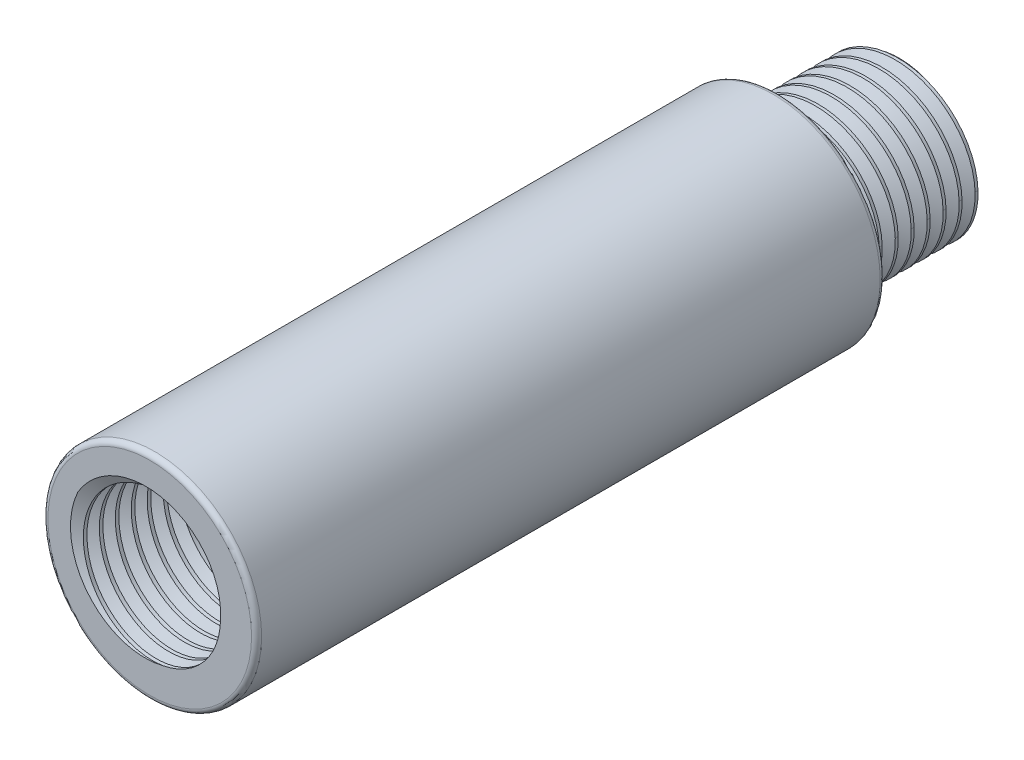
from build123d import *

# Parameters (mm, degrees)
SKETCH2_R           = 8.5
BOSS_EXTRUDE1_DEPTH = 50
FILLET1_R           = 0.4
SKETCH3_R           = 6.25
BOSS_EXTRUDE2_DEPTH = 10
CUT_SWEEP1_PITCH    = 1.27
SKETCH7_R           = 5.63
CUT_EXTRUDE1_DEPTH  = 10
CUT_SWEEP2_PITCH    = 1.27


with BuildPart() as part:
    # Sketch2 → Boss-Extrude1 (new body)
    with BuildSketch(Plane.XY):
        Circle(SKETCH2_R)
    extrude(amount=BOSS_EXTRUDE1_DEPTH)

    # Fillet1
    fillet1_edges = [part.edges().sort_by_distance(p)[0] for p in [
        (-8.5, 0, 0),
        (-8.5, 0, 50),
    ]]
    fillet(fillet1_edges, radius=FILLET1_R)

    # Sketch3 → Boss-Extrude2 (add)
    with BuildSketch(Plane(origin=(0, 0, 0), x_dir=(-1, 0, 0), z_dir=(0, 0, -1))):
        with Locations(Location((0, 0, 0), (0, 0, 180))):
            Circle(SKETCH3_R)
    extrude(amount=BOSS_EXTRUDE2_DEPTH)

    # Cut-Sweep1: arcs per turn and ends read off the stored shape
    # Cut-Sweep1: the profile of Sketch6 screwed along a right-hand helix through 8.25 turns, 8 arcs to a turn; built about Z, then put on its axis
    cut_sweep1_z = Axis((0, 0, 0), (0, 0, 1))
    cut_sweep1_corners = [(6.463090477, 0.020151731, -1.89311545), (5.352114959, 0.000938111, -1.299007519), (6.422384271, -0.020554475, -0.634431212)]
    with BuildLine(mode=Mode.PRIVATE) as cut_sweep1_profile:
        Line(cut_sweep1_corners[0], cut_sweep1_corners[1])
        Line(cut_sweep1_corners[1], cut_sweep1_corners[2])
        Line(cut_sweep1_corners[2], cut_sweep1_corners[0])
    cut_sweep1_cap = Face(cut_sweep1_profile.wire())
    cut_sweep1_turn_angles = [0, 22.5, 45, 67.5, 90, 112.5, 135, 157.5, 180, 202.5, 225, 247.5, 270, 292.5, 315, 337.5, 360]
    cut_sweep1_turn_weights = [1, 0.9238795325112867, 1, 0.9238795325112867, 1, 0.9238795325112867, 1, 0.9238795325112867, 1, 0.9238795325112867, 1, 0.9238795325112867, 1, 0.9238795325112867, 1, 0.9238795325112867, 1]
    cut_sweep1_turn_rails = [Edge.make_bspline([Vector(p[0], p[1], 0).rotate(cut_sweep1_z, cut_sweep1_turn_angles[k]) / cut_sweep1_turn_weights[k] + Vector(0, 0, p[2] + CUT_SWEEP1_PITCH * cut_sweep1_turn_angles[k] / 360) for k in range(17)], [0, 0, 0, 1, 1, 2, 2, 3, 3, 4, 4, 5, 5, 6, 6, 7, 7, 8, 8, 8], 2, cut_sweep1_turn_weights) for p in cut_sweep1_corners]
    cut_sweep1_turn_sides = [Face.make_surface_from_curves(cut_sweep1_turn_rails[p[0]], cut_sweep1_turn_rails[p[1]]) for p in [(0, 1), (1, 2), (2, 0)]]
    cut_sweep1_last_angles = [2880, 2902.5, 2925, 2947.5, 2970]
    cut_sweep1_last_weights = [1, 0.9238795325112867, 1, 0.9238795325112867, 1]
    cut_sweep1_last_rails = [Edge.make_bspline([Vector(p[0], p[1], 0).rotate(cut_sweep1_z, cut_sweep1_last_angles[k]) / cut_sweep1_last_weights[k] + Vector(0, 0, p[2] + CUT_SWEEP1_PITCH * cut_sweep1_last_angles[k] / 360) for k in range(5)], [0, 0, 0, 1, 1, 2, 2, 2], 2, cut_sweep1_last_weights) for p in cut_sweep1_corners]
    cut_sweep1_last_sides = [Face.make_surface_from_curves(cut_sweep1_last_rails[p[0]], cut_sweep1_last_rails[p[1]]) for p in [(0, 1), (1, 2), (2, 0)]]
    cut_sweep1 = Plane(origin=(0, 0, -10), x_dir=(0.7071067811865513, 0.7071067811865438, 0), z_dir=(0, 0, 1)) * Solid(Shell([*[p.moved(Location((0, 0, CUT_SWEEP1_PITCH * i))) for i in range(8) for p in cut_sweep1_turn_sides], *cut_sweep1_last_sides, cut_sweep1_cap, cut_sweep1_cap.rotate(cut_sweep1_z, 2970).moved(Location((0, 0, CUT_SWEEP1_PITCH * 2970 / 360)))]))
    add(cut_sweep1, mode=Mode.SUBTRACT)

    # Sketch7 → Cut-Extrude1 (cut)
    with BuildSketch(Plane.XY.offset(50)):
        Circle(SKETCH7_R)
    extrude(amount=-CUT_EXTRUDE1_DEPTH, mode=Mode.SUBTRACT)

    # Cut-Sweep2: arcs per turn and ends read off the stored shape
    # Cut-Sweep2: the profile of Sketch9 screwed along a right-hand helix through 7 turns, 8 arcs to a turn; built about Z, then put on its axis
    cut_sweep2_z = Axis((0, 0, 0), (0, 0, 1))
    cut_sweep2_corners = [(5.37048163, -0.023291111, -0.62125392), (6.483560981, -0.002105875, -1.211343358), (5.415659624, 0.021886883, -1.879632995)]
    with BuildLine(mode=Mode.PRIVATE) as cut_sweep2_profile:
        Line(cut_sweep2_corners[0], cut_sweep2_corners[1])
        Line(cut_sweep2_corners[1], cut_sweep2_corners[2])
        Line(cut_sweep2_corners[2], cut_sweep2_corners[0])
    cut_sweep2_cap = Face(cut_sweep2_profile.wire())
    cut_sweep2_turn_angles = [0, 22.5, 45, 67.5, 90, 112.5, 135, 157.5, 180, 202.5, 225, 247.5, 270, 292.5, 315, 337.5, 360]
    cut_sweep2_turn_weights = [1, 0.9238795325112867, 1, 0.9238795325112867, 1, 0.9238795325112867, 1, 0.9238795325112867, 1, 0.9238795325112867, 1, 0.9238795325112867, 1, 0.9238795325112867, 1, 0.9238795325112867, 1]
    cut_sweep2_turn_rails = [Edge.make_bspline([Vector(p[0], p[1], 0).rotate(cut_sweep2_z, cut_sweep2_turn_angles[k]) / cut_sweep2_turn_weights[k] + Vector(0, 0, p[2] + CUT_SWEEP2_PITCH * cut_sweep2_turn_angles[k] / 360) for k in range(17)], [0, 0, 0, 1, 1, 2, 2, 3, 3, 4, 4, 5, 5, 6, 6, 7, 7, 8, 8, 8], 2, cut_sweep2_turn_weights) for p in cut_sweep2_corners]
    cut_sweep2_turn_sides = [Face.make_surface_from_curves(cut_sweep2_turn_rails[p[0]], cut_sweep2_turn_rails[p[1]]) for p in [(0, 1), (1, 2), (2, 0)]]
    cut_sweep2 = Plane(origin=(0, 0, 50), x_dir=(-0.7071067811865513, 0.7071067811865438, 0), z_dir=(0, 0, -1)) * Solid(Shell([*[p.moved(Location((0, 0, CUT_SWEEP2_PITCH * i))) for i in range(7) for p in cut_sweep2_turn_sides], cut_sweep2_cap, cut_sweep2_cap.rotate(cut_sweep2_z, 2520).moved(Location((0, 0, CUT_SWEEP2_PITCH * 2520 / 360)))]))
    add(cut_sweep2, mode=Mode.SUBTRACT)


solid = part.part
